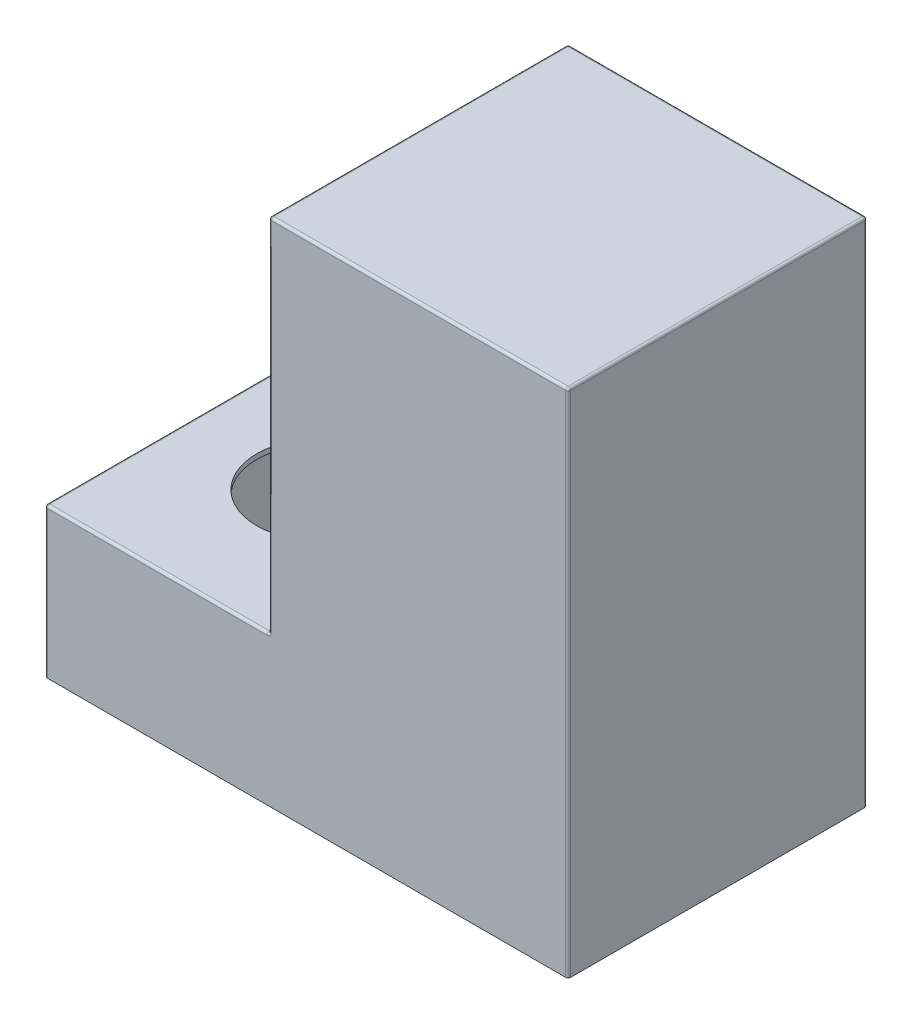
from build123d import *

# Parameters (mm, degrees)
SKETCH1_W           = 210
SKETCH1_H           = 205
BOSS_EXTRUDE1_DEPTH = 120
SKETCH2_W           = 90
SKETCH2_H           = 145
CUT_EXTRUDE1_DEPTH  = 120
SKETCH3_W           = 88
SKETCH3_H           = 116
CUT_EXTRUDE4_DEPTH  = 58
SKETCH6_W           = 116
SKETCH6_H           = 116
CUT_EXTRUDE6_DEPTH  = 203
SKETCH7_W           = 2
SKETCH7_H           = 116
CUT_EXTRUDE7_DEPTH  = 58
FILLET1_R           = 1
FILLET2_R           = 1
FILLET3_R           = 1
SKETCH8_R           = 25
CUT_EXTRUDE8_DEPTH  = 58


with BuildPart() as part:
    # Sketch1 → Boss-Extrude1 (new body)
    with BuildSketch(Plane.XY):
        Rectangle(SKETCH1_W, SKETCH1_H)
    extrude(amount=BOSS_EXTRUDE1_DEPTH)

    # Sketch2 → Cut-Extrude1 (cut)
    with BuildSketch(Plane.XY.offset(120)):
        with Locations((-60, 30)):
            Rectangle(SKETCH2_W, SKETCH2_H)
    extrude(amount=-CUT_EXTRUDE1_DEPTH, mode=Mode.SUBTRACT)

    # Sketch3 → Cut-Extrude4 (cut)
    with BuildSketch(Plane.XZ.offset(102.5)):
        with Locations((-59, 60)):
            Rectangle(SKETCH3_W, SKETCH3_H)
    extrude(amount=-CUT_EXTRUDE4_DEPTH, mode=Mode.SUBTRACT)

    # Sketch6 → Cut-Extrude6 (cut)
    with BuildSketch(Plane(origin=(0, -102.5, 0), x_dir=(-1, 0, 0), z_dir=(0, -1, 0))):
        with Locations((-45, -60)):
            Rectangle(SKETCH6_W, SKETCH6_H)
    extrude(amount=-CUT_EXTRUDE6_DEPTH, mode=Mode.SUBTRACT)

    # Sketch7 → Cut-Extrude7 (cut)
    with BuildSketch(Plane(origin=(0, -102.5, 0), x_dir=(-1, 0, 0), z_dir=(0, -1, 0))):
        with Locations((14, -60)):
            Rectangle(SKETCH7_W, SKETCH7_H)
    extrude(amount=-CUT_EXTRUDE7_DEPTH, mode=Mode.SUBTRACT)

    # Fillet1
    fillet1_edges = [part.edges().sort_by_distance(p)[0] for p in [
        (-105, -72.5, 0),
        (-105, -72.5, 120),
        (-15, 30, 0),
        (-15, 102.5, 60),
        (-60, -42.5, 0),
        (-15, -42.5, 60),
        (-60, -42.5, 120),
        (-15, 30, 120),
        (-103, -44.5, 60),
        (105, 0, 120),
        (45, 102.5, 120),
    ]]
    fillet(fillet1_edges, radius=FILLET1_R)

    # Fillet2
    # the kernel refuses this fillet: 1 mm, written as the material it takes off along each edge
    with BuildSketch(Plane(origin=(-14, 101.5, 1), x_dir=(0, 1, 0), z_dir=(0, 0, -1))) as fillet2_piece_1_section:
        Polygon((0, 0), (FILLET2_R, 0), (FILLET2_R, -FILLET2_R), (0, -FILLET2_R), align=None)
    fillet2_piece_1 = extrude(amount=FILLET2_R, mode=Mode.PRIVATE)
    fillet2_piece_1 = fillet2_piece_1 - Plane(origin=(-14, 101.5, 1), x_dir=(0.7071067811865476, -0.7071067811865475, 0), z_dir=(0, 0, -1)) * Sphere(FILLET2_R, mode=Mode.PRIVATE)
    add(fillet2_piece_1, mode=Mode.SUBTRACT)
    with BuildSketch(Plane(origin=(104, 101.5, 119), x_dir=(0, 1, 0), z_dir=(1, 0, 0))) as fillet2_piece_2_section:
        Polygon((0, 0), (FILLET2_R, 0), (FILLET2_R, FILLET2_R), (0, FILLET2_R), align=None)
    fillet2_piece_2 = extrude(amount=FILLET2_R, mode=Mode.PRIVATE)
    fillet2_piece_2 = fillet2_piece_2 - Plane(origin=(104, 101.5, 119), x_dir=(0, -0.7071067811865475, -0.7071067811865475), z_dir=(1, 0, 0)) * Sphere(FILLET2_R, mode=Mode.PRIVATE)
    add(fillet2_piece_2, mode=Mode.SUBTRACT)
    with BuildSketch(Plane(origin=(104, 101.5, 1), x_dir=(1, 0, 0), z_dir=(0, 0, -1))) as fillet2_piece_3_section:
        Polygon((0, 0), (FILLET2_R, 0), (FILLET2_R, -FILLET2_R), (0, -FILLET2_R), align=None)
    fillet2_piece_3 = extrude(amount=FILLET2_R, mode=Mode.PRIVATE)
    fillet2_piece_3 = fillet2_piece_3 - Plane(origin=(104, 101.5, 1), x_dir=(-0.7071067811865475, -0.7071067811865475, 0), z_dir=(0, 0, -1)) * Sphere(FILLET2_R, mode=Mode.PRIVATE)
    add(fillet2_piece_3, mode=Mode.SUBTRACT)
    with BuildSketch(Plane(origin=(104, 102.5, 0), x_dir=(0, -1, 0), z_dir=(-1, 0, 0))) as fillet2_piece_4:
        with BuildLine():
            CenterArc((FILLET2_R, FILLET2_R), FILLET2_R, 180, 90)
            Line((0, FILLET2_R), (0, 0))
            Line((0, 0), (FILLET2_R, 0))
        make_face()
    extrude(amount=118, mode=Mode.SUBTRACT)
    with BuildSketch(Plane(origin=(105, -105, 0), x_dir=(-1, 0, 0), z_dir=(0, 1, 0))) as fillet2_piece_5:
        with BuildLine():
            CenterArc((FILLET2_R, FILLET2_R), FILLET2_R, 180, 90)
            Line((0, FILLET2_R), (0, 0))
            Line((0, 0), (FILLET2_R, 0))
        make_face()
    extrude(amount=206.5, mode=Mode.SUBTRACT)
    with BuildSketch(Plane(origin=(105, 102.5, 1), x_dir=(0, -1, 0), z_dir=(0, 0, 1))) as fillet2_piece_6:
        with BuildLine():
            CenterArc((FILLET2_R, -FILLET2_R), FILLET2_R, 90, 90)
            Line((0, -FILLET2_R), (0, 0))
            Line((0, 0), (FILLET2_R, 0))
        make_face()
    extrude(amount=118, mode=Mode.SUBTRACT)

    # Fillet3
    # the kernel refuses this fillet: 1 mm, written as the material it takes off along each edge
    with BuildSketch(Plane(origin=(-104, -43.5, 1), x_dir=(0, 1, 0), z_dir=(-1, 0, 0))) as fillet3_piece_1_section:
        Polygon((0, 0), (FILLET3_R, 0), (FILLET3_R, FILLET3_R), (0, FILLET3_R), align=None)
    fillet3_piece_1 = extrude(amount=FILLET3_R, mode=Mode.PRIVATE)
    fillet3_piece_1 = fillet3_piece_1 - Plane(origin=(-104, -43.5, 1), x_dir=(0, -0.7071067811865475, 0.7071067811865475), z_dir=(-1, 0, 0)) * Sphere(FILLET3_R, mode=Mode.PRIVATE)
    add(fillet3_piece_1, mode=Mode.SUBTRACT)
    with BuildSketch(Plane(origin=(-104, -43.5, 119), x_dir=(0, 1, 0), z_dir=(-1, 0, 0))) as fillet3_piece_2_section:
        Polygon((0, 0), (FILLET3_R, 0), (FILLET3_R, -FILLET3_R), (0, -FILLET3_R), align=None)
    fillet3_piece_2 = extrude(amount=FILLET3_R, mode=Mode.PRIVATE)
    fillet3_piece_2 = fillet3_piece_2 - Plane(origin=(-104, -43.5, 119), x_dir=(0, -0.7071067811865475, -0.7071067811865475), z_dir=(-1, 0, 0)) * Sphere(FILLET3_R, mode=Mode.PRIVATE)
    add(fillet3_piece_2, mode=Mode.SUBTRACT)
    with BuildSketch(Plane(origin=(-105, -42.5, 119), x_dir=(0, -1, 0), z_dir=(0, 0, -1))) as fillet3_piece_3:
        with BuildLine():
            CenterArc((FILLET3_R, -FILLET3_R), FILLET3_R, 90, 90)
            Line((0, -FILLET3_R), (0, 0))
            Line((0, 0), (FILLET3_R, 0))
        make_face()
    extrude(amount=118, mode=Mode.SUBTRACT)

    # Sketch8 → Cut-Extrude8 (cut)
    with BuildSketch(Plane(origin=(0, -42.5, 0), x_dir=(1, 0, 0), z_dir=(0, 1, 0))):
        with Locations(Location((-55, -60, 0), (0, 0, 270))):
            Circle(SKETCH8_R)
    extrude(amount=-CUT_EXTRUDE8_DEPTH, mode=Mode.SUBTRACT)


solid = part.part
